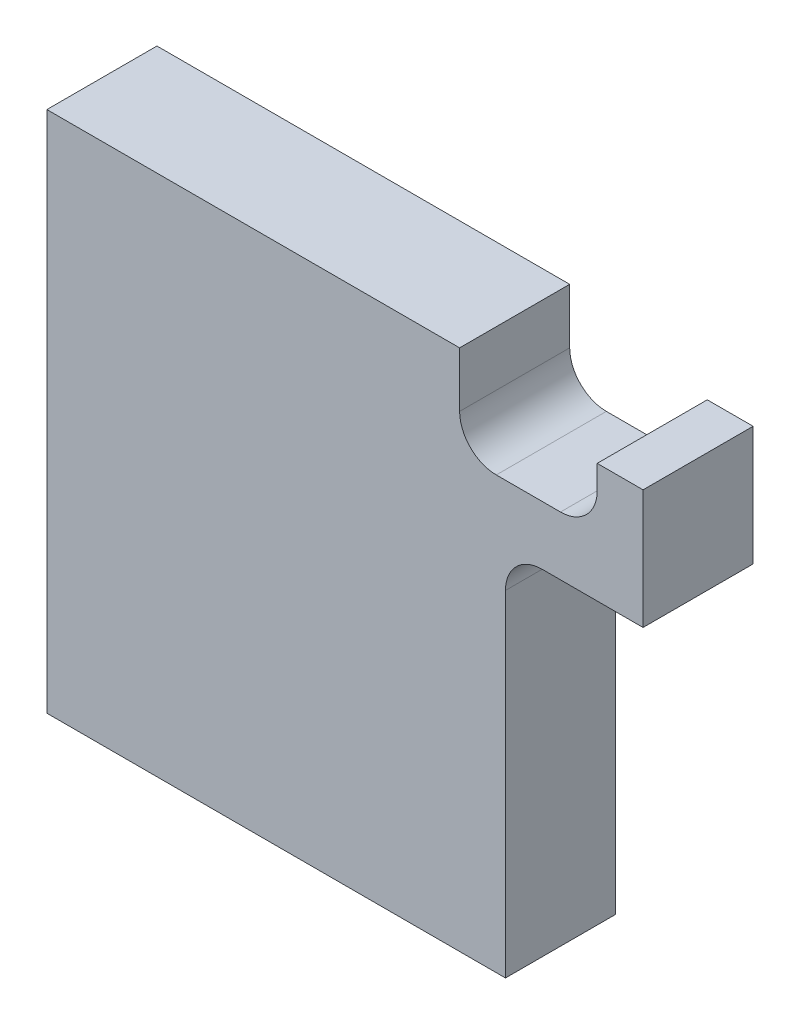
from build123d import *

# Parameters (mm, degrees)
EXTRUDE_1_DEPTH = 1.2
FILLET1_R       = 0.4


with BuildPart() as part:
    # 草图1 → 凸台-拉伸1 (new body)
    with BuildSketch(Plane.XY):
        Polygon((4.219252835, 10.5), (4.219252835, 4.8), (9.219252835, 4.8), (9.219252835, 8.859461555), (10.719252835, 8.859461555), (10.719252835, 10.159461555), (10.219252835, 10.159461555), (10.219252835, 9.5), (8.719252835, 9.5), (8.719252835, 10.5), align=None)
    extrude(amount=EXTRUDE_1_DEPTH)

    # Fillet1
    fillet1_edges = [part.edges().sort_by_distance(p)[0] for p in [
        (9.219252835, 8.859461555, 0.6),
        (10.219252835, 9.5, 0.6),
        (8.719252835, 9.5, 0.6),
    ]]
    fillet(fillet1_edges, radius=FILLET1_R)


solid = part.part
